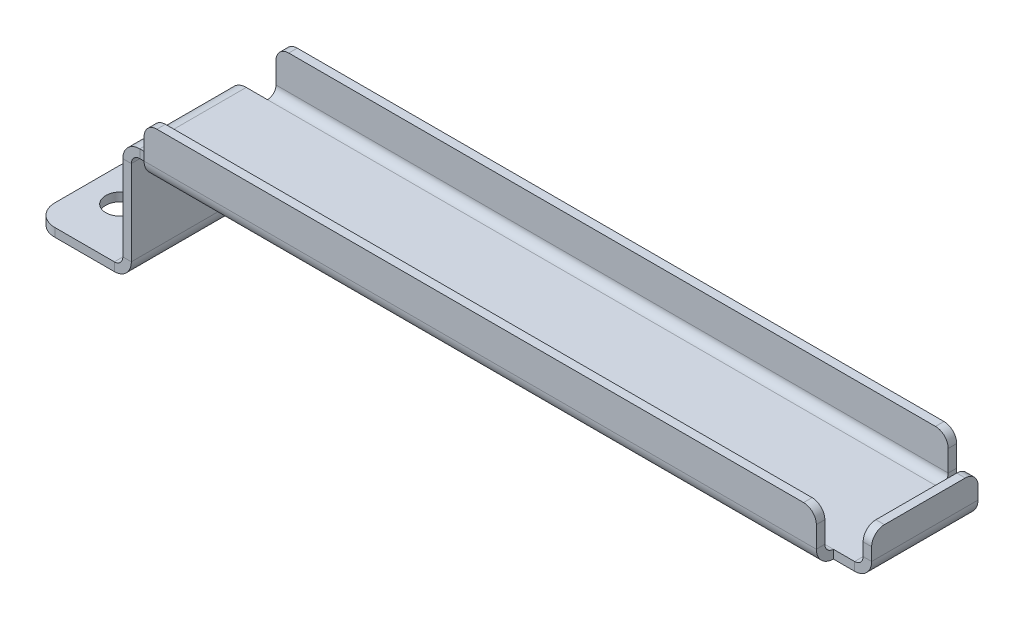
from build123d import *

# Parameters (mm, degrees)
SKETCH_1_W                  = 158
SKETCH_1_H                  = 25
SM_BASE_FLANGE_1_DEPTH      = 2
SM_EDGE_FLANGE_1_DEPTH      = 158
SM_EDGE_FLANGE_1_BEND_DEPTH = 158
SM_EDGE_FLANGE_2_DEPTH      = 25
SM_EDGE_FLANGE_3_DEPTH      = 25
SM_EDGE_FLANGE_4_DEPTH      = 25
FILLET_1_R                  = 3
SKETCH_21_R                 = 3.5
CUT_EXTRUDE_1_DEPTH         = 10
FILLET_2_R                  = 5


# Sheet-metal steps are written as plain solids
with BuildPart() as part:
    # Sketch 1 → Базовая кромка1 (new body)
    with BuildSketch(Plane(origin=(0, 0, 0), x_dir=(1, 0, 0), z_dir=(0, 1, 0))):
        Rectangle(SKETCH_1_W, SKETCH_1_H)
    extrude(amount=-SM_BASE_FLANGE_1_DEPTH)

    # Ребро-кромка1 section (across the edge) → Ребро-кромка1 (add)
    with BuildSketch(Plane(origin=(79, 0, -14.5), x_dir=(0, 0, 1), z_dir=(-1, 0, 0))):
        with BuildLine():
            Line((-2, 2), (-2, 10))
            Line((-2, 10), (0, 10))
            Line((0, 10), (0, 2))
            ThreePointArc((0, 2), (0.585786438, 0.585786438), (2, 0))
            Line((2, 0), (2, -2))
            ThreePointArc((2, -2), (-0.828427125, -0.828427125), (-2, 2))
        make_face()
    extrude(amount=SM_EDGE_FLANGE_1_DEPTH)

    # Ребро-кромка1 section 2 (across the edge) → Ребро-кромка1 bend (add)
    with BuildSketch(Plane(origin=(-79, 0, 14.5), x_dir=(0, 0, -1), z_dir=(1, 0, 0))):
        with BuildLine():
            Line((-2, 2), (-2, 10))
            Line((-2, 10), (0, 10))
            Line((0, 10), (0, 2))
            ThreePointArc((0, 2), (0.585786438, 0.585786438), (2, 0))
            Line((2, 0), (2, -2))
            ThreePointArc((2, -2), (-0.828427125, -0.828427125), (-2, 2))
        make_face()
    extrude(amount=SM_EDGE_FLANGE_1_BEND_DEPTH)

    # Ребро-кромка2 section (across the edge) → Ребро-кромка2 (add)
    with BuildSketch(Plane(origin=(86, 0, 12.5), x_dir=(-1, 0, 0), z_dir=(0, 0, -1))):
        with BuildLine():
            Line((-2, 2), (-2, 8))
            Line((-2, 8), (0, 8))
            Line((0, 8), (0, 2))
            ThreePointArc((0, 2), (0.585786438, 0.585786438), (2, 0))
            Line((2, 0), (7, 0))
            Line((7, 0), (7, -2))
            Line((7, -2), (2, -2))
            ThreePointArc((2, -2), (-0.828427125, -0.828427125), (-2, 2))
        make_face()
    extrude(amount=SM_EDGE_FLANGE_2_DEPTH)

    # Ребро-кромка3 section (across the edge) → Ребро-кромка3 (add)
    with BuildSketch(Plane(origin=(-86, -2, 12.5), x_dir=(1, 0, 0), z_dir=(0, 0, -1))):
        with BuildLine():
            Line((-2, 2), (-2, 22))
            Line((-2, 22), (0, 22))
            Line((0, 22), (0, 2))
            ThreePointArc((0, 2), (0.585786438, 0.585786438), (2, 0))
            Line((2, 0), (7, 0))
            Line((7, 0), (7, -2))
            Line((7, -2), (2, -2))
            ThreePointArc((2, -2), (-0.828427125, -0.828427125), (-2, 2))
        make_face()
    extrude(amount=SM_EDGE_FLANGE_3_DEPTH)

    # Ребро-кромка4 section (across the edge) → Ребро-кромка4 (add)
    with BuildSketch(Plane(origin=(-88, -26, -12.5), x_dir=(0, 1, 0), z_dir=(0, 0, 1))):
        with BuildLine():
            Line((-2, 2), (-2, 21))
            Line((-2, 21), (0, 21))
            Line((0, 21), (0, 2))
            ThreePointArc((0, 2), (0.585786438, 0.585786438), (2, 0))
            Line((2, 0), (2, -2))
            ThreePointArc((2, -2), (-0.828427125, -0.828427125), (-2, 2))
        make_face()
    extrude(amount=SM_EDGE_FLANGE_4_DEPTH)

    # Скругление1
    fillet_1_edges = [part.edges().sort_by_distance(p)[0] for p in [
        (79, 10, -15.5),
        (-79, 10, -15.5),
        (-79, 10, 15.5),
        (79, 10, 15.5),
        (87, 8, 12.5),
        (87, 8, -12.5),
    ]]
    fillet(fillet_1_edges, radius=FILLET_1_R)

    # Эскиз21 → Вырез-Вытянуть1 (cut)
    with BuildSketch(Plane(origin=(0, -26, 0), x_dir=(1, 0, 0), z_dir=(0, 1, 0))):
        with Locations(Location((-101, 0, 0), (0, 0, 270))):
            Circle(SKETCH_21_R)
    extrude(amount=-CUT_EXTRUDE_1_DEPTH, mode=Mode.SUBTRACT)

    # Скругление2
    fillet_2_edges = [part.edges().sort_by_distance(p)[0] for p in [
        (-109, -27, -12.5),
        (-109, -27, 12.5),
    ]]
    fillet(fillet_2_edges, radius=FILLET_2_R)


solid = part.part
